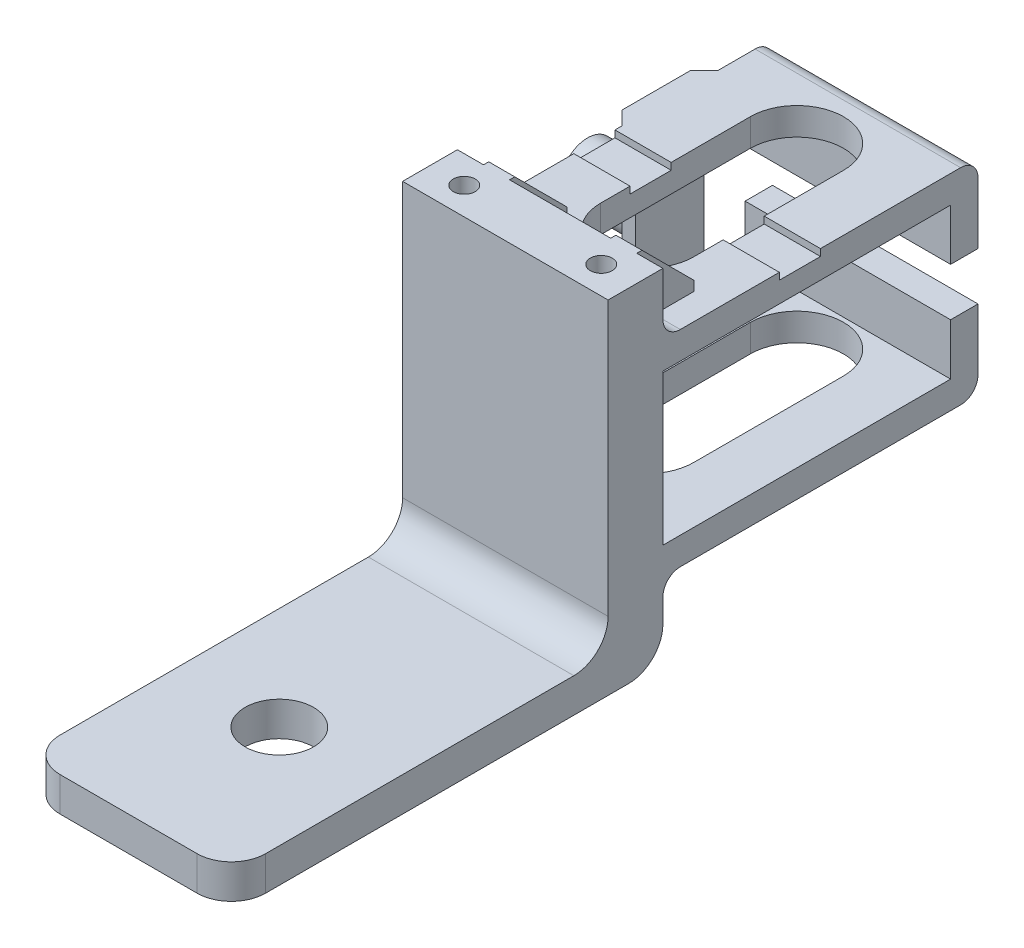
from build123d import *

# Parameters (mm, degrees)
SKETCH1_W           = 63
SKETCH1_H           = 5
BOSS_EXTRUDE1_DEPTH = 30
SKETCH2_W           = 30
SKETCH2_H           = 8
BOSS_EXTRUDE2_DEPTH = 45
SKETCH3_R           = 5
CUT_EXTRUDE1_DEPTH  = 84.030115019
SKETCH5_R           = 1.6
CUT_EXTRUDE3_DEPTH  = 14
FILLET1_R           = 5
BOSS_EXTRUDE3_DEPTH = 30
FILLET2_R           = 2.54
CUT_EXTRUDE5_DEPTH  = 121.258055863
BOSS_EXTRUDE4_REACH = 122.258
SKETCH9_W           = 3.81
SKETCH9_H           = 8.378131559
CHAMFER1_SIZE       = 7.62
SKETCH10_W          = 3.81
SKETCH10_H          = 8.378131559
BOSS_EXTRUDE5_DEPTH = 6
CHAMFER2_SIZE       = 7.62
SKETCH11_W          = 4
SKETCH11_H          = 7
CUT_EXTRUDE6_DEPTH  = 124.616341962
SKETCH13_W          = 10
SKETCH13_H          = 30
BOSS_EXTRUDE6_DEPTH = 2
SKETCH14_R          = 4
BOSS_EXTRUDE7_DEPTH = 10
CHAMFER3_SIZE       = 2
SKETCH15_W          = 30
SKETCH15_H          = 6
CUT_EXTRUDE7_DEPTH  = 1


# Some blends are built 0.0001 mm under size
with BuildPart() as part:
    # Sketch1 → Boss-Extrude1 (new body)
    with BuildSketch(Plane(origin=(0, 0, 0), x_dir=(0, 0, -1), z_dir=(1, 0, 0))):
        with Locations((31.5, 2.5)):
            Rectangle(SKETCH1_W, SKETCH1_H)
    extrude(amount=BOSS_EXTRUDE1_DEPTH)

    # Sketch2 → Boss-Extrude2 (add)
    with BuildSketch(Plane(origin=(0, 5, 0), x_dir=(1, 0, 0), z_dir=(0, 1, 0))):
        with Locations((15, 59)):
            Rectangle(SKETCH2_W, SKETCH2_H)
    extrude(amount=BOSS_EXTRUDE2_DEPTH)

    # Sketch3 → Cut-Extrude1 (cut, through all)
    with BuildSketch(Plane(origin=(0, 5, 0), x_dir=(1, 0, 0), z_dir=(0, 1, 0))):
        with Locations(Location((15, 22, 0), (0, 0, 270))):
            Circle(SKETCH3_R)
    extrude(amount=-CUT_EXTRUDE1_DEPTH, mode=Mode.SUBTRACT)

    # Sketch5 → Cut-Extrude3 (cut)
    with BuildSketch(Plane(origin=(0, 50, 0), x_dir=(1, 0, 0), z_dir=(0, 1, 0))):
        with Locations(Location((5, 59, 0), (0, 0, 270))):
            Circle(SKETCH5_R)
        with Locations(Location((25, 59, 0), (0, 0, 270))):
            Circle(SKETCH5_R)
    extrude(amount=-CUT_EXTRUDE3_DEPTH, mode=Mode.SUBTRACT)

    # Fillet1
    fillet1_edges = [part.edges().sort_by_distance(p)[0] for p in [
        (15, 5, -55),
        (30, 2.5, 0),
        (0, 2.5, 0),
        (15, 0, -63),
    ]]
    fillet(fillet1_edges, radius=FILLET1_R)

    # Sketch6 → Boss-Extrude3 (add)
    with BuildSketch(Plane(origin=(30, 0, 0), x_dir=(0, 0, -1), z_dir=(1, 0, 0))):
        Polygon((63, 41), (63, 37), (105, 37), (105, 15), (63, 15), (63, 11), (109, 11), (109, 41), align=None)
    extrude(amount=-BOSS_EXTRUDE3_DEPTH)

    # Fillet2
    fillet2_edges = [part.edges().sort_by_distance(p)[0] for p in [
        (15, 41, -109),
        (15, 11, -109),
        (15, 11, -63),
        (15, 41, -63),
    ]]
    fillet(fillet2_edges, radius=FILLET2_R)

    # Sketch8 → Cut-Extrude5 (cut, through all)
    with BuildSketch(Plane(origin=(0, 41, 0), x_dir=(1, 0, 0), z_dir=(0, 1, 0))):
        with BuildLine():
            Line((21.793359881, 97.57), (21.793359881, 75.7))
            ThreePointArc((21.793359881, 75.7), (15, 68.906640119), (8.206640119, 75.7))
            Line((8.206640119, 75.7), (8.206640119, 97.57))
            ThreePointArc((8.206640119, 97.57), (15, 104.363359881), (21.793359881, 97.57))
        make_face()
    extrude(amount=-CUT_EXTRUDE5_DEPTH, mode=Mode.SUBTRACT)

    # Boss-Extrude4: up to this face of the body (flat: up to its plane)
    boss_extrude4_end = Plane(part.part.faces().sort_by_distance((15, 50, -59))[0])
    # Sketch9 → Boss-Extrude4 (add, up to the picked face)
    with BuildSketch(Plane(origin=(0, 41, 0), x_dir=(1, 0, 0), z_dir=(0, 1, 0)), mode=Mode.PRIVATE) as boss_extrude4_sk1:
        with Locations((5.715, 67.18906578)):
            Rectangle(SKETCH9_W, SKETCH9_H)
    boss_extrude4_tool1 = split(extrude(boss_extrude4_sk1.sketch, amount=BOSS_EXTRUDE4_REACH, mode=Mode.PRIVATE), bisect_by=boss_extrude4_end, keep=Keep.BOTH, mode=Mode.PRIVATE)
    # Sketch9 → Boss-Extrude4 (add, up to the picked face)
    with BuildSketch(Plane(origin=(0, 41, 0), x_dir=(1, 0, 0), z_dir=(0, 1, 0)), mode=Mode.PRIVATE) as boss_extrude4_sk2:
        with Locations((24.285, 67.18906578)):
            Rectangle(SKETCH9_W, SKETCH9_H)
    boss_extrude4_tool2 = split(extrude(boss_extrude4_sk2.sketch, amount=BOSS_EXTRUDE4_REACH, mode=Mode.PRIVATE), bisect_by=boss_extrude4_end, keep=Keep.BOTH, mode=Mode.PRIVATE)
    add(boss_extrude4_tool1.solids().sort_by(Axis((5.715, 41, -67.189066), (0, 1, 0)))[0])
    add(boss_extrude4_tool2.solids().sort_by(Axis((24.285, 41, -67.189066), (0, 1, 0)))[0])

    # Chamfer1
    chamfer1_edges = [part.edges().sort_by_distance(p)[0] for p in [
        (5.715, 50, -71.378131559),
        (24.285, 50, -71.378131559),
    ]]
    chamfer(chamfer1_edges, length=CHAMFER1_SIZE)

    # Sketch10 → Boss-Extrude5 (add)
    with BuildSketch(Plane.XZ.offset(-11)):
        with Locations((5.715, -67.18906578)):
            Rectangle(SKETCH10_W, SKETCH10_H)
        with Locations((24.285, -67.18906578)):
            Rectangle(SKETCH10_W, SKETCH10_H)
    extrude(amount=BOSS_EXTRUDE5_DEPTH)

    # Chamfer2
    # the kernel refuses this chamfer: 7.62 mm, written as the material it takes off along each edge
    with BuildSketch(Plane(origin=(45.786224368, 5, -71.378131559), x_dir=(0, -0.027495876610586386, 0.9996219169112968), z_dir=(-1, 0, 0))) as chamfer2_piece_1_section:
        Polygon((CHAMFER2_SIZE * 0.999621916911, CHAMFER2_SIZE * 0.0274958766106), (-CHAMFER2_SIZE * 0.0274958766106, CHAMFER2_SIZE * 0.999621916911), (0, 0), align=None)
    chamfer2_piece_1 = extrude(amount=43.002448737, mode=Mode.PRIVATE)
    chamfer2_piece_1 = split(chamfer2_piece_1, bisect_by=Plane(origin=(24.285, 11, -68.732360766), z_dir=(0, -1, 0)), keep=Keep.TOP, mode=Mode.PRIVATE)
    add(chamfer2_piece_1, mode=Mode.SUBTRACT)
    with BuildSketch(Plane(origin=(27.216224368, 5, -71.378131559), x_dir=(0, -0.027495876610586386, 0.9996219169112968), z_dir=(-1, 0, 0))) as chamfer2_piece_2_section:
        Polygon((CHAMFER2_SIZE * 0.999621916911, CHAMFER2_SIZE * 0.0274958766106), (-CHAMFER2_SIZE * 0.0274958766106, CHAMFER2_SIZE * 0.999621916911), (0, 0), align=None)
    chamfer2_piece_2 = extrude(amount=43.002448737, mode=Mode.PRIVATE)
    chamfer2_piece_2 = split(chamfer2_piece_2, bisect_by=Plane(origin=(5.715, 11, -68.732360766), z_dir=(0, -1, 0)), keep=Keep.TOP, mode=Mode.PRIVATE)
    add(chamfer2_piece_2, mode=Mode.SUBTRACT)

    # Sketch11 → Cut-Extrude6 (cut, through all)
    with BuildSketch(Plane(origin=(30, 0, 0), x_dir=(0, 0, -1), z_dir=(1, 0, 0))):
        with Locations((107, 26)):
            Rectangle(SKETCH11_W, SKETCH11_H)
    extrude(amount=-CUT_EXTRUDE6_DEPTH, mode=Mode.SUBTRACT)

    # Sketch13 → Boss-Extrude6 (add)
    with BuildSketch(Plane.ZY):
        with Locations((-94, 26)):
            Rectangle(SKETCH13_W, SKETCH13_H)
    extrude(amount=BOSS_EXTRUDE6_DEPTH)

    # Sketch14 → Boss-Extrude7 (add)
    with BuildSketch(Plane.ZY.offset(2)):
        with Locations((-94, 26)):
            Circle(SKETCH14_R)
    extrude(amount=BOSS_EXTRUDE7_DEPTH)

    # Chamfer3
    chamfer3_edges = [part.edges().sort_by_distance(p)[0] for p in [
        (0, 13, -89),
        (0, 39, -89),
        (0, 13, -99),
        (0, 39, -99),
    ]]
    chamfer(chamfer3_edges, length=CHAMFER3_SIZE - 0.0001)  # a hair under: the kernel refuses the full size

    # Sketch15 → Cut-Extrude7 (cut)
    with BuildSketch(Plane(origin=(0, 41, 0), x_dir=(1, 0, 0), z_dir=(0, 1, 0))):
        with Locations((15, 83)):
            Rectangle(SKETCH15_W, SKETCH15_H)
    extrude(amount=-CUT_EXTRUDE7_DEPTH, mode=Mode.SUBTRACT)


solid = part.part
